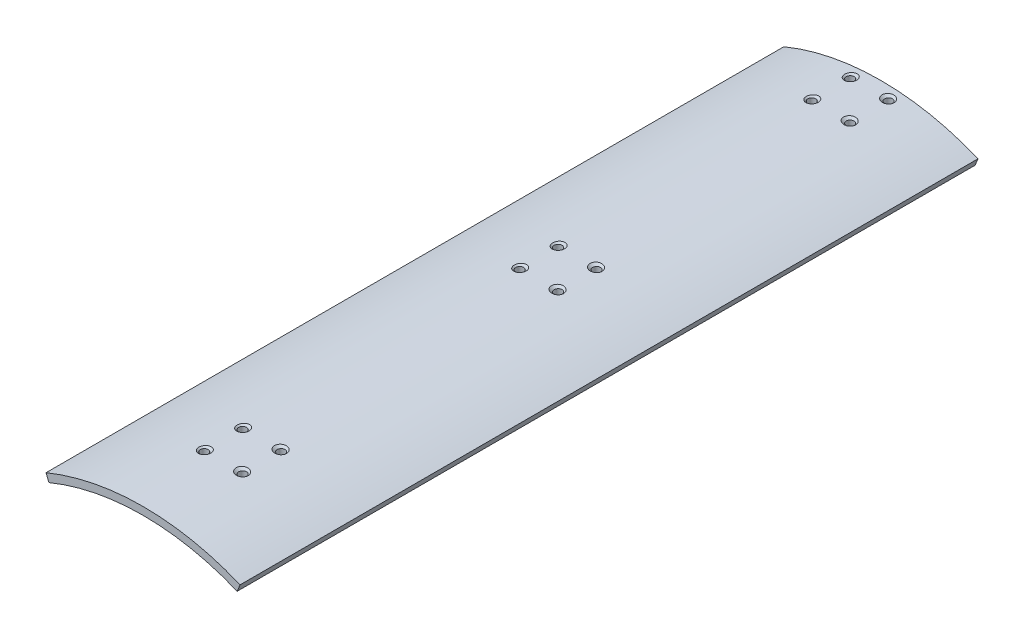
from build123d import *

# Parameters (mm, degrees)
BOSS_EXTRUDE1_DEPTH                               = 152.4
BOSS_EXTRUDE1_DEPTH_BACK                          = 152.4
CSK_FOR_4_FLAT_HEAD_MACHINE_SCREW_100_D           = 3.2639
CSK_FOR_4_FLAT_HEAD_MACHINE_SCREW_100_CSINK_D     = 5.715
CSK_FOR_4_FLAT_HEAD_MACHINE_SCREW_100_CSINK_ANGLE = 100


with BuildPart() as part:
    # Sketch1 → Boss-Extrude1 (new, two sides: drawn at the far end of the back side and taken through both)
    with BuildSketch(Plane.XY.offset(-BOSS_EXTRUDE1_DEPTH_BACK)):
        with BuildLine():
            Line((-40.095656626, 96.799478019), (-38.880636728, 93.866160503))
            ThreePointArc((-38.880636728, 93.866160503), (0, 101.6), (38.880636728, 93.866160503))
            Line((38.880636728, 93.866160503), (40.095656626, 96.799478019))
            ThreePointArc((40.095656626, 96.799478019), (0, 104.775), (-40.095656626, 96.799478019))
        make_face()
    extrude(amount=BOSS_EXTRUDE1_DEPTH + BOSS_EXTRUDE1_DEPTH_BACK)

    # CSK for #4 Flat Head Machine Screw (100)2 (through all)
    with Locations(Plane(origin=(0, 104.775, 0), x_dir=(1, 0, 0), z_dir=(0, 1, 0))):
        with Locations((7.9375, 147.6375), (7.9375, 131.7625), (-7.9375, 131.7625), (-7.9375, 147.6375), (7.9375, 26.9875), (7.9375, 11.1125), (-7.9375, 11.1125), (-7.9375, 26.9875), (7.9375, -103.3145), (7.9375, -119.1895), (-7.9375, -119.1895), (-7.9375, -103.3145)):
            CounterSinkHole(CSK_FOR_4_FLAT_HEAD_MACHINE_SCREW_100_D / 2, CSK_FOR_4_FLAT_HEAD_MACHINE_SCREW_100_CSINK_D / 2, counter_sink_angle=CSK_FOR_4_FLAT_HEAD_MACHINE_SCREW_100_CSINK_ANGLE)


solid = part.part
